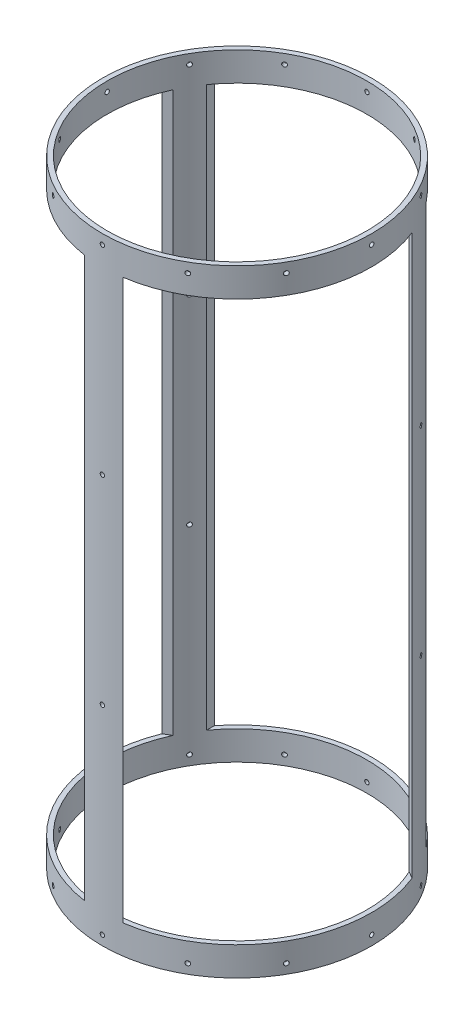
from build123d import *

# Parameters (mm, degrees)
SKETCH1_R                = 88.9
SKETCH1_R_2              = 85.725
BOSS_EXTRUDE1_DEPTH      = 203.581
CUT_EXTRUDE1_REACH       = 241.273
CUT_EXTRUDE1_END_RADIUS  = 88.9
SKETCH2_W                = 139.7
SKETCH2_H                = 369.062
CIRPATTERN1_COUNT        = 3
SKETCH4_R                = 1.4351
CUT_EXTRUDE3_DEPTH       = 15.24
CIRPATTERN3_COUNT        = 12
MIRROR1_COPY_1_SKETCH_R  = 1.4351
MIRROR1_COPY_1_DEPTH     = 15.24
MIRROR1_COPY_2_SKETCH_R  = 1.4351
MIRROR1_COPY_2_DEPTH     = 15.24
MIRROR1_COPY_3_SKETCH_R  = 1.4351
MIRROR1_COPY_3_DEPTH     = 15.24
MIRROR1_COPY_4_SKETCH_R  = 1.4351
MIRROR1_COPY_4_DEPTH     = 15.24
MIRROR1_COPY_5_SKETCH_R  = 1.4351
MIRROR1_COPY_5_DEPTH     = 15.24
MIRROR1_COPY_6_SKETCH_R  = 1.4351
MIRROR1_COPY_6_DEPTH     = 15.24
MIRROR1_COPY_7_SKETCH_R  = 1.4351
MIRROR1_COPY_7_DEPTH     = 15.24
MIRROR1_COPY_8_SKETCH_R  = 1.4351
MIRROR1_COPY_8_DEPTH     = 15.24
MIRROR1_COPY_9_SKETCH_R  = 1.4351
MIRROR1_COPY_9_DEPTH     = 15.24
MIRROR1_COPY_10_SKETCH_R = 1.4351
MIRROR1_COPY_10_DEPTH    = 15.24
MIRROR1_COPY_11_SKETCH_R = 1.4351
MIRROR1_COPY_11_DEPTH    = 15.24
SKETCH5_R                = 1.4351
CUT_EXTRUDE4_DEPTH       = 46.482
CIRPATTERN4_COUNT        = 3


with BuildPart() as part:
    # Sketch1 → Boss-Extrude1 (new, symmetric)
    with BuildSketch(Plane(origin=(0, 0, 0), x_dir=(1, 0, 0), z_dir=(0, 1, 0))):
        Circle(SKETCH1_R)
        Circle(SKETCH1_R_2, mode=Mode.SUBTRACT)
    extrude(amount=BOSS_EXTRUDE1_DEPTH, both=True)

    # Cut-Extrude1: up to this cylinder (the profile starts inside it)
    cut_extrude1_end = Plane(origin=(0, 0, 0), z_dir=(0, -1, 0)) * Cylinder(CUT_EXTRUDE1_END_RADIUS, 661.346, mode=Mode.PRIVATE)
    # Sketch2 → Cut-Extrude1 (cut, up to the surface)
    with BuildSketch(Plane.XY, mode=Mode.PRIVATE) as cut_extrude1_sk1:
        Rectangle(SKETCH2_W, SKETCH2_H)
    cut_extrude1_tool1 = extrude(cut_extrude1_sk1.sketch, amount=-CUT_EXTRUDE1_REACH, mode=Mode.PRIVATE) & cut_extrude1_end
    cut_extrude1 = cut_extrude1_tool1.solids().sort_by_distance((0, 0, 0))[0]
    add(cut_extrude1, mode=Mode.SUBTRACT)

    # CirPattern1: Cut-Extrude1 ×3 about axis
    cirpattern1_axis = Axis((0, 203.581, 0), (0, -1, 0))
    for i in range(1, CIRPATTERN1_COUNT):
        add(cut_extrude1.rotate(cirpattern1_axis, i * 360 / CIRPATTERN1_COUNT), mode=Mode.SUBTRACT)

    # Sketch4 → Cut-Extrude3 (cut)
    with BuildSketch(Plane(origin=(88.9, 0, 0), x_dir=(0, 0, -1), z_dir=(1, 0, 0))):
        with Locations((0, 197.231)):
            Circle(SKETCH4_R)
    cut_extrude3 = extrude(amount=-CUT_EXTRUDE3_DEPTH, mode=Mode.SUBTRACT)

    # CirPattern3: Cut-Extrude3 ×12 about axis
    cirpattern3_axis = Axis((0, 203.581, 0), (0, -1, 0))
    for i in range(1, CIRPATTERN3_COUNT):
        add(cut_extrude3.rotate(cirpattern3_axis, i * 360 / CIRPATTERN3_COUNT), mode=Mode.SUBTRACT)

    # Mirror1: Cut-Extrude3 across plane
    add(cut_extrude3.mirror(Plane.ZX), mode=Mode.SUBTRACT)

    # Mirror1 copy 1 sketch → Mirror1 copy 1 (cut)
    with BuildSketch(Plane(origin=(76.989658396, 0, 44.45), x_dir=(0.49999999999999994, 0, -0.8660254037844387), z_dir=(0.8660254037844387, 0, 0.49999999999999994))):
        with Locations((0, -197.231)):
            Circle(MIRROR1_COPY_1_SKETCH_R)
    extrude(amount=-MIRROR1_COPY_1_DEPTH, mode=Mode.SUBTRACT)

    # Mirror1 copy 2 sketch → Mirror1 copy 2 (cut)
    with BuildSketch(Plane(origin=(44.45, 0, 76.989658396), x_dir=(0.8660254037844386, 0, -0.5000000000000001), z_dir=(0.5000000000000001, 0, 0.8660254037844386))):
        with Locations((0, -197.231)):
            Circle(MIRROR1_COPY_2_SKETCH_R)
    extrude(amount=-MIRROR1_COPY_2_DEPTH, mode=Mode.SUBTRACT)

    # Mirror1 copy 3 sketch → Mirror1 copy 3 (cut)
    with BuildSketch(Plane.XY.offset(88.9)):
        with Locations((0, -197.231)):
            Circle(MIRROR1_COPY_3_SKETCH_R)
    extrude(amount=-MIRROR1_COPY_3_DEPTH, mode=Mode.SUBTRACT)

    # Mirror1 copy 4 sketch → Mirror1 copy 4 (cut)
    with BuildSketch(Plane(origin=(-44.45, 0, 76.989658396), x_dir=(0.8660254037844387, 0, 0.4999999999999998), z_dir=(-0.4999999999999998, 0, 0.8660254037844387))):
        with Locations((0, -197.231)):
            Circle(MIRROR1_COPY_4_SKETCH_R)
    extrude(amount=-MIRROR1_COPY_4_DEPTH, mode=Mode.SUBTRACT)

    # Mirror1 copy 5 sketch → Mirror1 copy 5 (cut)
    with BuildSketch(Plane(origin=(-76.989658396, 0, 44.45), x_dir=(0.49999999999999994, 0, 0.8660254037844387), z_dir=(-0.8660254037844387, 0, 0.49999999999999994))):
        with Locations((0, -197.231)):
            Circle(MIRROR1_COPY_5_SKETCH_R)
    extrude(amount=-MIRROR1_COPY_5_DEPTH, mode=Mode.SUBTRACT)

    # Mirror1 copy 6 sketch → Mirror1 copy 6 (cut)
    with BuildSketch(Plane.ZY.offset(88.9)):
        with Locations((0, -197.231)):
            Circle(MIRROR1_COPY_6_SKETCH_R)
    extrude(amount=-MIRROR1_COPY_6_DEPTH, mode=Mode.SUBTRACT)

    # Mirror1 copy 7 sketch → Mirror1 copy 7 (cut)
    with BuildSketch(Plane(origin=(-76.989658396, 0, -44.45), x_dir=(-0.5000000000000001, 0, 0.8660254037844386), z_dir=(-0.8660254037844386, 0, -0.5000000000000001))):
        with Locations((0, -197.231)):
            Circle(MIRROR1_COPY_7_SKETCH_R)
    extrude(amount=-MIRROR1_COPY_7_DEPTH, mode=Mode.SUBTRACT)

    # Mirror1 copy 8 sketch → Mirror1 copy 8 (cut)
    with BuildSketch(Plane(origin=(-44.45, 0, -76.989658396), x_dir=(-0.8660254037844384, 0, 0.5000000000000004), z_dir=(-0.5000000000000004, 0, -0.8660254037844384))):
        with Locations((0, -197.231)):
            Circle(MIRROR1_COPY_8_SKETCH_R)
    extrude(amount=-MIRROR1_COPY_8_DEPTH, mode=Mode.SUBTRACT)

    # Mirror1 copy 9 sketch → Mirror1 copy 9 (cut)
    with BuildSketch(Plane(origin=(0, 0, -88.9), x_dir=(-1, 0, 0), z_dir=(0, 0, -1))):
        with Locations((0, -197.231)):
            Circle(MIRROR1_COPY_9_SKETCH_R)
    extrude(amount=-MIRROR1_COPY_9_DEPTH, mode=Mode.SUBTRACT)

    # Mirror1 copy 10 sketch → Mirror1 copy 10 (cut)
    with BuildSketch(Plane(origin=(44.45, 0, -76.989658396), x_dir=(-0.8660254037844386, 0, -0.5000000000000001), z_dir=(0.5000000000000001, 0, -0.8660254037844386))):
        with Locations((0, -197.231)):
            Circle(MIRROR1_COPY_10_SKETCH_R)
    extrude(amount=-MIRROR1_COPY_10_DEPTH, mode=Mode.SUBTRACT)

    # Mirror1 copy 11 sketch → Mirror1 copy 11 (cut)
    with BuildSketch(Plane(origin=(76.989658396, 0, -44.45), x_dir=(-0.5000000000000004, 0, -0.8660254037844384), z_dir=(0.8660254037844384, 0, -0.5000000000000004))):
        with Locations((0, -197.231)):
            Circle(MIRROR1_COPY_11_SKETCH_R)
    extrude(amount=-MIRROR1_COPY_11_DEPTH, mode=Mode.SUBTRACT)

    # Sketch5 → Cut-Extrude4 (cut)
    with BuildSketch(Plane.XY.offset(88.9)):
        with Locations((0, -65.7606)):
            Circle(SKETCH5_R)
        with Locations((0, 65.7606)):
            Circle(SKETCH5_R)
    cut_extrude4 = extrude(amount=-CUT_EXTRUDE4_DEPTH, mode=Mode.SUBTRACT)

    # CirPattern4: Cut-Extrude4 ×3 about axis
    cirpattern4_axis = Axis((0, 203.581, 0), (0, -1, 0))
    for i in range(1, CIRPATTERN4_COUNT):
        add(cut_extrude4.rotate(cirpattern4_axis, i * 360 / CIRPATTERN4_COUNT), mode=Mode.SUBTRACT)


solid = part.part
